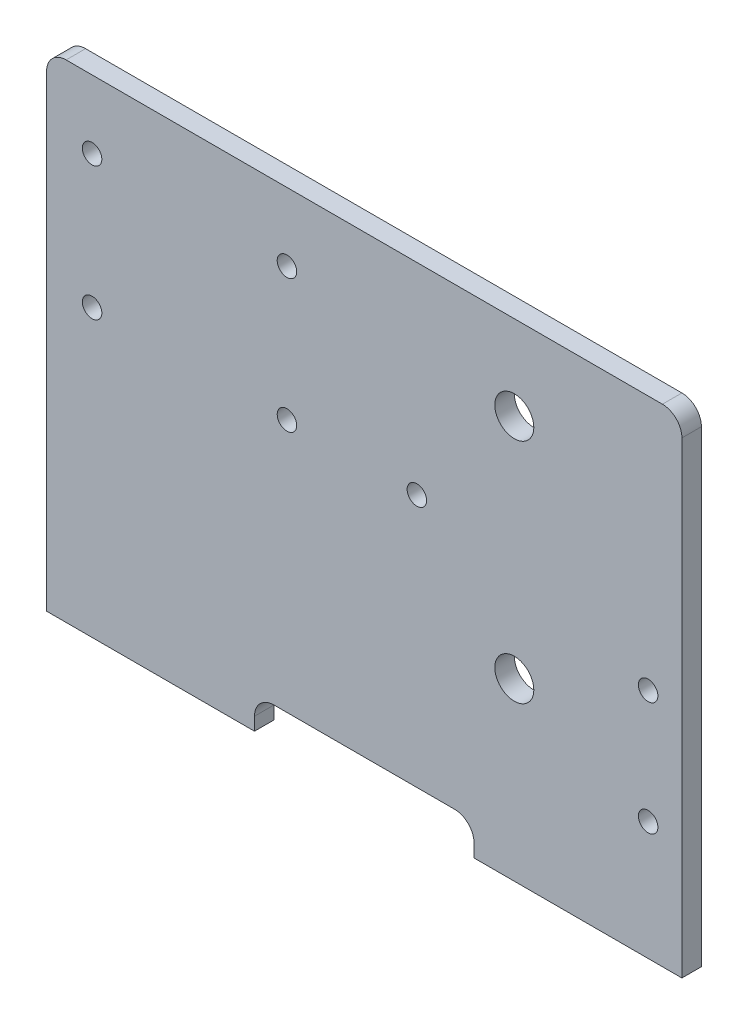
from build123d import *

# Parameters (mm, degrees)
CROQUIS1_W              = 97.8
CROQUIS1_H              = 75
CROQUIS1_R              = 1.5
CROQUIS1_R_2            = 3
SALIENTE_EXTRUIR1_DEPTH = 1.5
CROQUIS2_W              = 33.8
CROQUIS2_H              = 5
CORTAR_EXTRUIR1_DEPTH   = 62.696515299
REDONDEO1_R             = 3


with BuildPart() as part:
    # Croquis1 → Saliente-Extruir1 (new, symmetric)
    with BuildSketch(Plane.XY):
        Rectangle(CROQUIS1_W, CROQUIS1_H)
        with Locations((-41.9, 27)):
            Circle(CROQUIS1_R, mode=Mode.SUBTRACT)
        with Locations((-11.9, 27)):
            Circle(CROQUIS1_R, mode=Mode.SUBTRACT)
        with Locations((-11.9, 6.5)):
            Circle(CROQUIS1_R, mode=Mode.SUBTRACT)
        with Locations((-41.9, 6.5)):
            Circle(CROQUIS1_R, mode=Mode.SUBTRACT)
        with Locations((23.1, -10.5)):
            Circle(CROQUIS1_R_2, mode=Mode.SUBTRACT)
        with Locations((23.1, 24.5)):
            Circle(CROQUIS1_R_2, mode=Mode.SUBTRACT)
        with Locations((8.1, 6.5)):
            Circle(CROQUIS1_R, mode=Mode.SUBTRACT)
        with Locations((43.7, -1.75)):
            Circle(CROQUIS1_R, mode=Mode.SUBTRACT)
        with Locations((43.7, -19.25)):
            Circle(CROQUIS1_R, mode=Mode.SUBTRACT)
    extrude(amount=SALIENTE_EXTRUIR1_DEPTH, both=True)

    # Croquis2 → Cortar-Extruir1 (cut, through all)
    with BuildSketch(Plane.XY.offset(1.5)):
        with Locations((0, -35)):
            Rectangle(CROQUIS2_W, CROQUIS2_H)
    extrude(amount=-CORTAR_EXTRUIR1_DEPTH, mode=Mode.SUBTRACT)

    # Redondeo1
    redondeo1_edges = [part.edges().sort_by_distance(p)[0] for p in [
        (-48.9, 37.5, 0),
        (48.9, 37.5, 0),
        (16.9, -32.5, 0),
        (-16.9, -32.5, 0),
    ]]
    fillet(redondeo1_edges, radius=REDONDEO1_R)


solid = part.part
